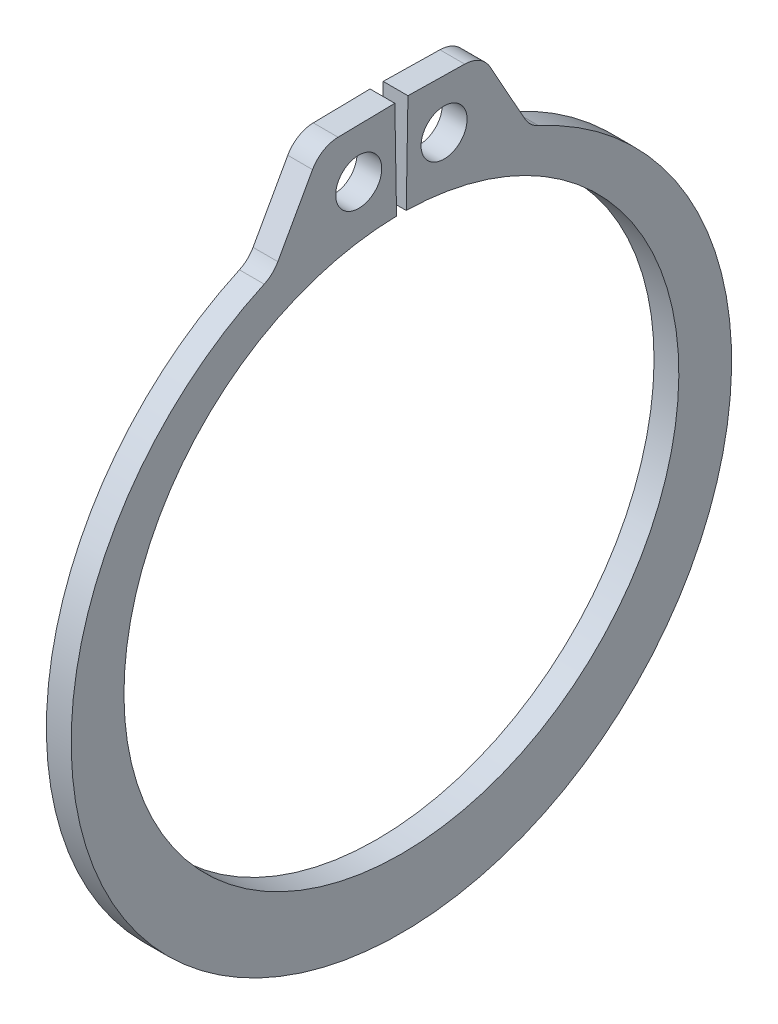
from build123d import *

# Parameters (mm, degrees)
SKETCH1_R      = 0.9906
EXTRUDE1_DEPTH = 0.5334
FILLET1_R      = 1.2827


with BuildPart() as part:
    # Sketch1 → Extrude1 (new, symmetric)
    with BuildSketch(Plane(origin=(0, 0, 0), x_dir=(0, 0, -1), z_dir=(1, 0, 0))):
        with BuildLine():
            Line((-0.208346828, 11.936181785), (-0.282376446, 16.177335738))
            Line((-0.282376446, 16.177335738), (-3.463241911, 16.121813525))
            Line((-3.463241911, 16.121813525), (-5.525332907, 12.414975524))
            ThreePointArc((-5.525332907, 12.414975524), (0, -14.8844), (5.525332907, 12.414975524))
            Line((5.525332907, 12.414975524), (3.463241911, 16.121813525))
            Line((3.463241911, 16.121813525), (0.282376446, 16.177335738))
            Line((0.282376446, 16.177335738), (0.208346828, 11.936181785))
            ThreePointArc((0.208346828, 11.936181785), (0, -11.938), (-0.208346828, 11.936181785))
        make_face()
        with Locations((-1.835794369, 14.028997655)):
            Circle(SKETCH1_R, mode=Mode.SUBTRACT)
        with Locations((1.835794369, 14.028997655)):
            Circle(SKETCH1_R, mode=Mode.SUBTRACT)
    extrude(amount=EXTRUDE1_DEPTH, both=True)

    # Fillet1
    fillet1_edges = [part.edges().sort_by_distance(p)[0] for p in [
        (0, 12.414975524, 5.525332907),
        (0, 12.414975524, -5.525332907),
        (0, 16.121813525, 3.463241911),
        (0, 16.121813525, -3.463241911),
    ]]
    fillet(fillet1_edges, radius=FILLET1_R)


solid = part.part
